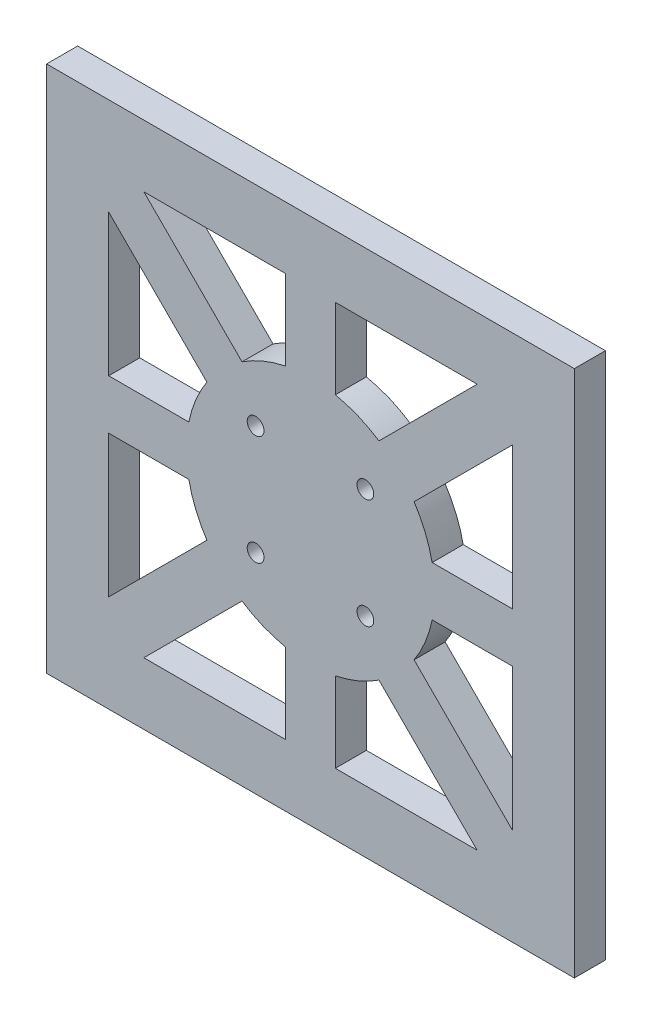
from build123d import *

# Parameters (mm, degrees)
CROQUIS1_W              = 85
CROQUIS1_H              = 85
CROQUIS1_R              = 1.35
SALIENTE_EXTRUIR1_DEPTH = 5


with BuildPart() as part:
    # Croquis1 → Saliente-Extruir1 (new body)
    with BuildSketch(Plane.XY.offset(1012.9)):
        with Locations((-72.207592574, 40.615670498)):
            Rectangle(CROQUIS1_W, CROQUIS1_H)
        with BuildLine():
            Line((-99.050738324, 73.115670498), (-76.207592574, 73.115670498))
            Line((-76.207592574, 73.115670498), (-76.207592574, 60.21158844))
            ThreePointArc((-76.207592574, 60.21158844), (-79.861261221, 59.093261148), (-83.23557191, 57.300504083))
            Line((-83.23557191, 57.300504083), (-99.050738324, 73.115670498))
        make_face(mode=Mode.SUBTRACT)
        with BuildLine():
            Line((-104.707592574, 67.458816249), (-88.892426159, 51.643649834))
            ThreePointArc((-88.892426159, 51.643649834), (-90.685183224, 48.269339145), (-91.803510516, 44.615670498))
            Line((-91.803510516, 44.615670498), (-104.707592574, 44.615670498))
            Line((-104.707592574, 44.615670498), (-104.707592574, 67.458816249))
        make_face(mode=Mode.SUBTRACT)
        with BuildLine():
            Line((-104.707592574, 36.615670498), (-91.803510516, 36.615670498))
            ThreePointArc((-91.803510516, 36.615670498), (-90.685183224, 32.962001851), (-88.892426159, 29.587691162))
            Line((-88.892426159, 29.587691162), (-104.707592574, 13.772524748))
            Line((-104.707592574, 13.772524748), (-104.707592574, 36.615670498))
        make_face(mode=Mode.SUBTRACT)
        with BuildLine():
            Line((-99.050738324, 8.115670498), (-83.23557191, 23.930836913))
            ThreePointArc((-83.23557191, 23.930836913), (-79.861261221, 22.138079848), (-76.207592574, 21.019752556))
            Line((-76.207592574, 21.019752556), (-76.207592574, 8.115670498))
            Line((-76.207592574, 8.115670498), (-99.050738324, 8.115670498))
        make_face(mode=Mode.SUBTRACT)
        with BuildLine():
            Line((-68.207592574, 8.115670498), (-68.207592574, 21.019752556))
            ThreePointArc((-68.207592574, 21.019752556), (-64.553923927, 22.138079848), (-61.179613238, 23.930836913))
            Line((-61.179613238, 23.930836913), (-45.364446823, 8.115670498))
            Line((-45.364446823, 8.115670498), (-68.207592574, 8.115670498))
        make_face(mode=Mode.SUBTRACT)
        with BuildLine():
            Line((-39.707592574, 13.772524748), (-55.522758989, 29.587691162))
            ThreePointArc((-55.522758989, 29.587691162), (-53.730001924, 32.962001851), (-52.611674632, 36.615670498))
            Line((-52.611674632, 36.615670498), (-39.707592574, 36.615670498))
            Line((-39.707592574, 36.615670498), (-39.707592574, 13.772524748))
        make_face(mode=Mode.SUBTRACT)
        with BuildLine():
            ThreePointArc((-52.611674632, 44.615670498), (-53.730001924, 48.269339145), (-55.522758989, 51.643649834))
            Line((-55.522758989, 51.643649834), (-39.707592574, 67.458816249))
            Line((-39.707592574, 67.458816249), (-39.707592574, 44.615670498))
            Line((-39.707592574, 44.615670498), (-52.611674632, 44.615670498))
        make_face(mode=Mode.SUBTRACT)
        with BuildLine():
            Line((-45.364446823, 73.115670498), (-61.179613238, 57.300504083))
            ThreePointArc((-61.179613238, 57.300504083), (-64.553923927, 59.093261148), (-68.207592574, 60.21158844))
            Line((-68.207592574, 60.21158844), (-68.207592574, 73.115670498))
            Line((-68.207592574, 73.115670498), (-45.364446823, 73.115670498))
        make_face(mode=Mode.SUBTRACT)
        with Locations((-63.368757809, 49.454505263)):
            Circle(CROQUIS1_R, mode=Mode.SUBTRACT)
        with Locations((-81.046427339, 31.776835733)):
            Circle(CROQUIS1_R, mode=Mode.SUBTRACT)
        with Locations((-63.368757809, 31.776835733)):
            Circle(CROQUIS1_R, mode=Mode.SUBTRACT)
        with Locations((-81.046427339, 49.454505263)):
            Circle(CROQUIS1_R, mode=Mode.SUBTRACT)
    extrude(amount=SALIENTE_EXTRUIR1_DEPTH)


solid = part.part
